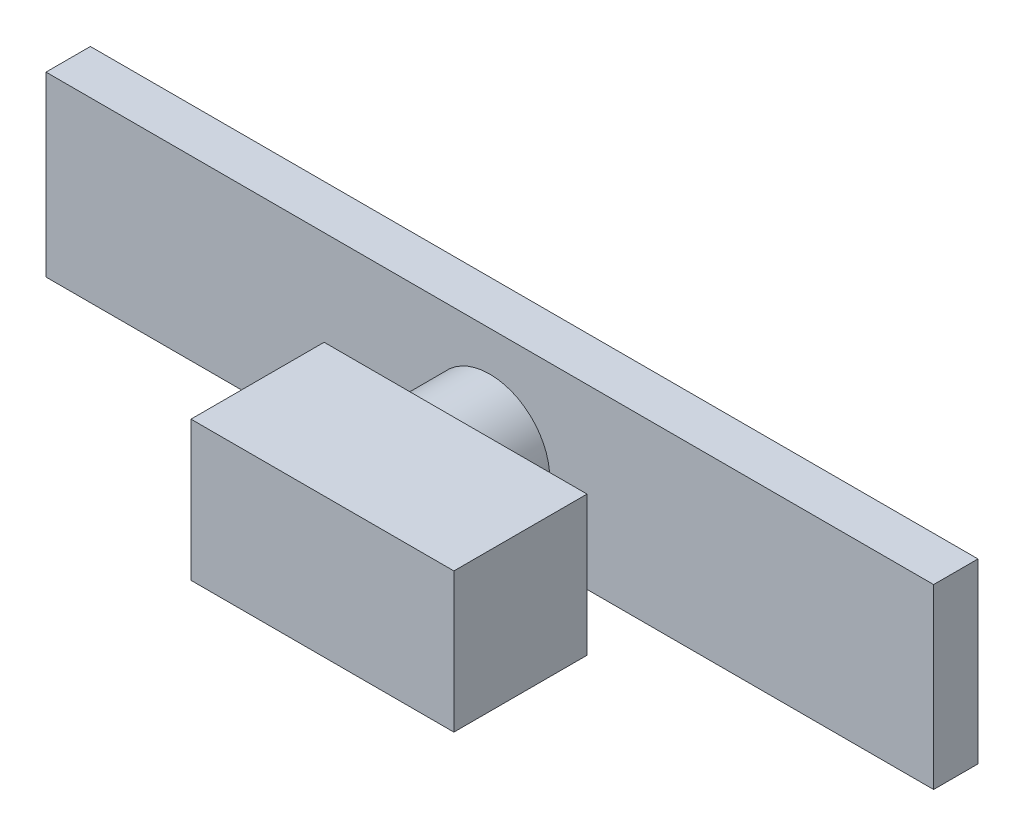
from build123d import *

# Parameters (mm, degrees)
SKETCH2_W             = 254
SKETCH2_H             = 12.7
BOSS_EXTRUDE1_DEPTH   = 50.8
SKETCH3_R             = 17.140791438
BOSS_EXTRUDE2_DEPTH   = 19.05
SKETCH4_W             = 75.235944222
SKETCH4_H             = 39.955088207
BOSS_EXTRUDE3_DEPTH   = 38.1
SCALE2_SCALE          = 0.06
BODY_MOVE_COPY1_ANGLE = 90
SCALE5_SCALE          = 0.25
SCALE6_SCALE          = 0.25


with BuildPart() as part:
    # Sketch2 → Boss-Extrude1 (new body)
    with BuildSketch(Plane.XY):
        with Locations((79.130769231, 14.898076923)):
            Rectangle(SKETCH2_W, SKETCH2_H)
    extrude(amount=BOSS_EXTRUDE1_DEPTH)

    # Sketch3 → Boss-Extrude2 (add)
    with BuildSketch(Plane(origin=(0, 21.248076923, 0), x_dir=(1, 0, 0), z_dir=(0, 1, 0))):
        with Locations((79.130769231, -28.483063876)):
            Circle(SKETCH3_R)
    extrude(amount=BOSS_EXTRUDE2_DEPTH)

    # Sketch4 → Boss-Extrude3 (add)
    with BuildSketch(Plane(origin=(0, 40.298076923, 0), x_dir=(1, 0, 0), z_dir=(0, 1, 0))):
        with Locations((88.38546847, -28.088530296)):
            Rectangle(SKETCH4_W, SKETCH4_H)
    extrude(amount=BOSS_EXTRUDE3_DEPTH)


with BuildPart() as part_1:
    # Scale2: scaled about (82.711857342, 33.041003565, 26.623476887)
    add(part.part.scale(SCALE2_SCALE).moved(Location((77.749145901, 31.058543351, 25.026068274))))


with BuildPart() as part_2:
    # Body-Move/Copy1: moved
    add(part_1.part.rotate(Axis((0, 33.666927966, 26.550068274), (1, 0, 0)), BODY_MOVE_COPY1_ANGLE))


with BuildPart() as part_3:
    # Body-Move/Copy3: moved
    add(part_2.part.moved(Location((-50.8, 0, -50.8))))


with BuildPart() as part_4:
    # Scale5: scaled about (31.911857342, 33.593519353, -24.875856127)
    add(part_3.part.scale(SCALE5_SCALE).moved(Location((23.933893006, 25.195139515, -18.656892095))))


with BuildPart() as part_5:
    # Body-Move/Copy9: moved
    add(part_4.part.moved(Location((-50.8, 0, 0))))


with BuildPart() as part_6:
    # Scale6: scaled about (-18.888142658, 33.593519353, -24.875856127)
    add(part_5.part.scale(SCALE6_SCALE).moved(Location((-14.166106993, 25.195139515, -18.656892095))))


solid = part_6.part
